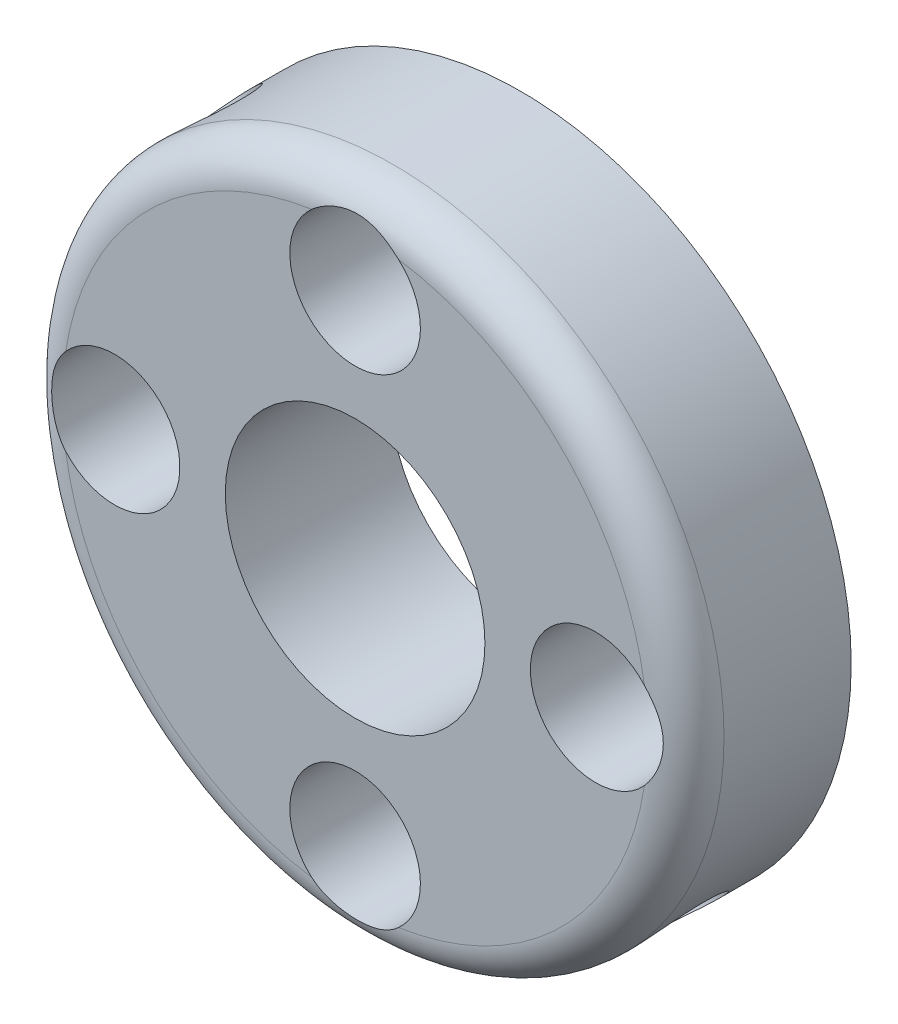
from build123d import *

# Parameters (mm, degrees)
SKETCH2_R           = 11
SKETCH2_R_2         = 4.318
SKETCH2_R_3         = 1
BOSS_EXTRUDE1_DEPTH = 2
SKETCH3_R           = 11
SKETCH3_R_2         = 4.318
SKETCH3_R_3         = 2.171511002
BOSS_EXTRUDE2_DEPTH = 3.5
SKETCH5_R           = 1.5
CUT_EXTRUDE1_DEPTH  = 127
FILLET1_R           = 1.27


with BuildPart() as part:
    # Sketch2 → Boss-Extrude1 (new body)
    with BuildSketch(Plane.XY):
        Circle(SKETCH2_R)
        Circle(SKETCH2_R_2, mode=Mode.SUBTRACT)
        with Locations((0, 8)):
            Circle(SKETCH2_R_3, mode=Mode.SUBTRACT)
        with Locations((8, 0)):
            Circle(SKETCH2_R_3, mode=Mode.SUBTRACT)
        with Locations((0, -8)):
            Circle(SKETCH2_R_3, mode=Mode.SUBTRACT)
        with Locations((-8, 0)):
            Circle(SKETCH2_R_3, mode=Mode.SUBTRACT)
    extrude(amount=BOSS_EXTRUDE1_DEPTH)

    # Sketch3 → Boss-Extrude2 (add)
    with BuildSketch(Plane.XY.offset(2)):
        Circle(SKETCH3_R)
        Circle(SKETCH3_R_2, mode=Mode.SUBTRACT)
        with Locations((0, 8)):
            Circle(SKETCH3_R_3, mode=Mode.SUBTRACT)
        with Locations((8, 0)):
            Circle(SKETCH3_R_3, mode=Mode.SUBTRACT)
        with Locations((0, -8)):
            Circle(SKETCH3_R_3, mode=Mode.SUBTRACT)
        with Locations((-8, 0)):
            Circle(SKETCH3_R_3, mode=Mode.SUBTRACT)
    extrude(amount=BOSS_EXTRUDE2_DEPTH)

    # Sketch5 → Cut-Extrude1 (cut, symmetric)
    with BuildSketch(Plane(origin=(0, 0, 0), x_dir=(0.7071067811865477, 0.7071067811865475, 0), z_dir=(-0.7071067811865475, 0.7071067811865477, 0))):
        with Locations(Location((0, -2.668898501, 0), (0, 0, 180))):
            Circle(SKETCH5_R)
    extrude(amount=CUT_EXTRUDE1_DEPTH, both=True, mode=Mode.SUBTRACT)

    # Fillet1
    # the kernel refuses this fillet: 1.27 mm, written as the material it takes off along each edge
    with BuildSketch(Plane(origin=(0, 0, 5.5), x_dir=(1, 0, 0), z_dir=(0, -1, 0))) as fillet1_piece_1:
        with BuildLine():
            CenterArc((11 - FILLET1_R, -FILLET1_R), FILLET1_R, 0, 90)
            Line((11 - FILLET1_R, 0), (11, 0))
            Line((11, 0), (11, -FILLET1_R))
        make_face()
    revolve(axis=Axis((0, 0, 5.5), (0, 0, 1)), mode=Mode.SUBTRACT)


solid = part.part
